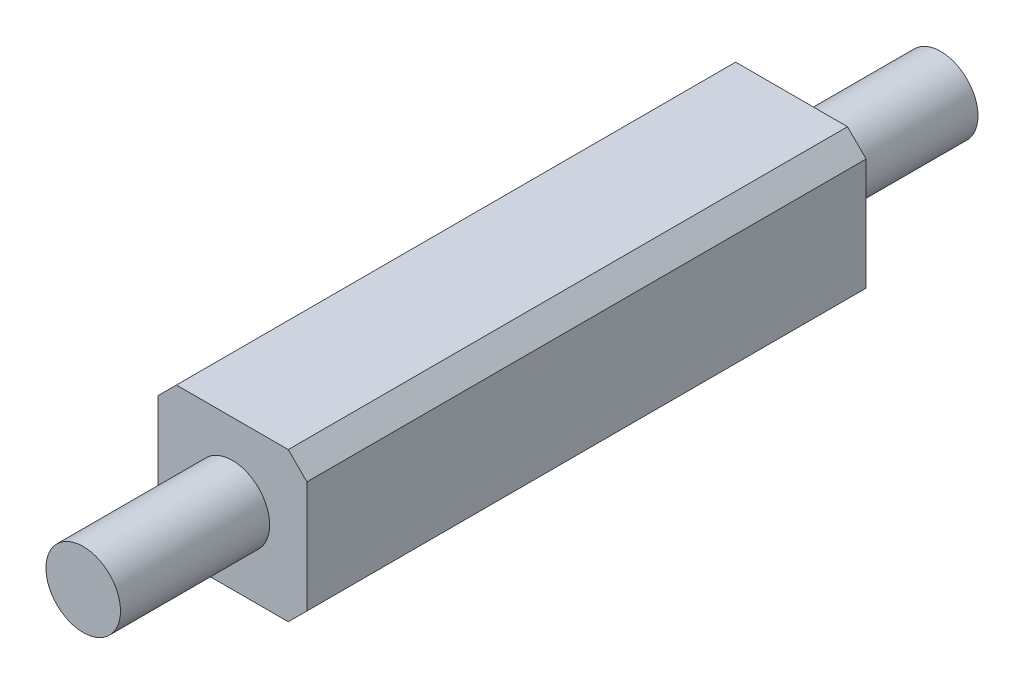
from build123d import *

# Parameters (mm, degrees)
SKETCH1_W                = 4
SKETCH1_H                = 15
BOSS_EXTRUDE1_DEPTH      = 4
BOSS_EXTRUDE2_DEPTH      = 4
BOSS_EXTRUDE2_DEPTH_BACK = 19
SKETCH2_R                = 1
CHAMFER1_SIZE            = 0.5


with BuildPart() as part:
    # Sketch1 → Boss-Extrude1 (new body)
    with BuildSketch(Plane(origin=(0, 0, 0), x_dir=(1, 0, 0), z_dir=(0, 1, 0))):
        Rectangle(SKETCH1_W, SKETCH1_H)
    extrude(amount=BOSS_EXTRUDE1_DEPTH)

    # Sketch2 → Boss-Extrude2 (add, two sides: drawn at the far end of the back side and taken through both)
    with BuildSketch(Plane.XY.offset(7.5).offset(-BOSS_EXTRUDE2_DEPTH_BACK)):
        with Locations((0, 2)):
            Circle(SKETCH2_R)
    extrude(amount=BOSS_EXTRUDE2_DEPTH + BOSS_EXTRUDE2_DEPTH_BACK)

    # Chamfer1
    chamfer1_edges = [part.edges().sort_by_distance(p)[0] for p in [
        (-2, 0, 0),
        (-2, 4, 0),
        (2, 0, 0),
        (2, 4, 0),
    ]]
    chamfer(chamfer1_edges, length=CHAMFER1_SIZE)


solid = part.part
